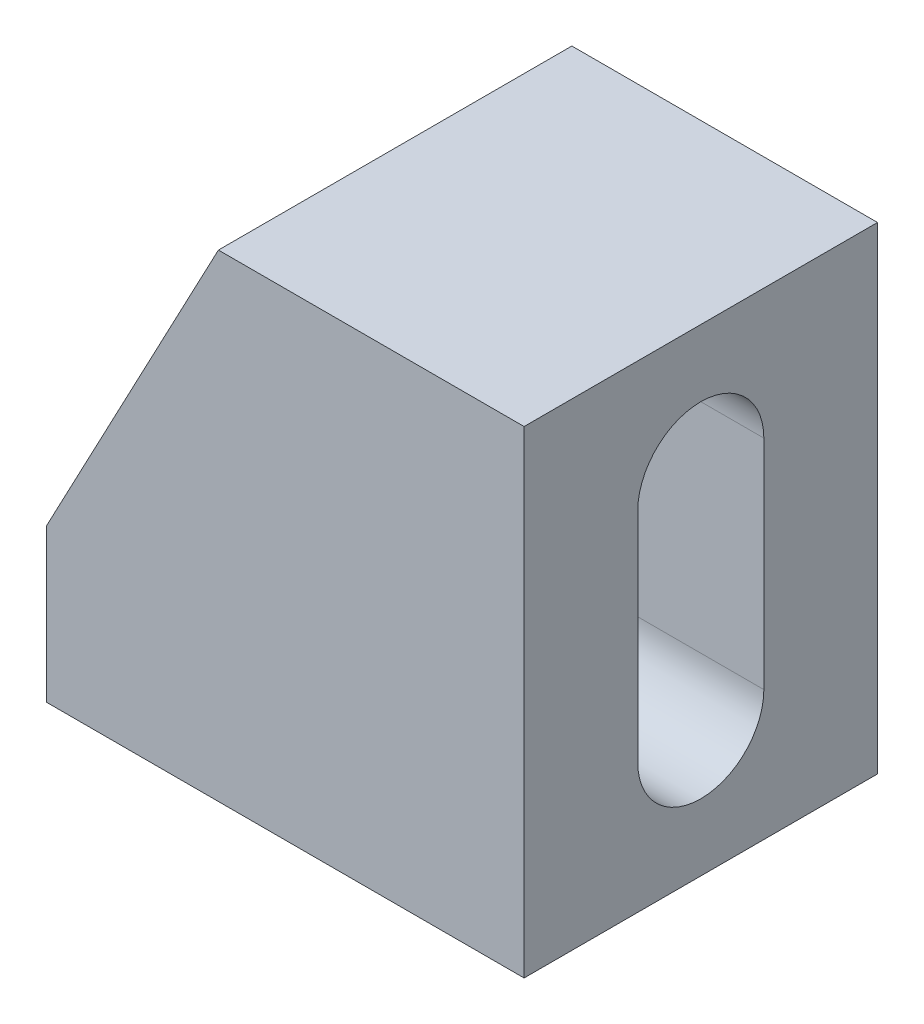
from build123d import *

# Parameters (mm, degrees)
BOSS_EXTRUDE2_DEPTH      = 9.25
M6_CLEARANCE_SLOT1_DEPTH = 25


# Read off the part's stored shape, not the designer's step: M6 Clearance Slot1
with BuildPart() as part:
    # Sketch2 → Boss-Extrude2 (new, symmetric)
    with BuildSketch(Plane.XY):
        Polygon((0, 0), (0, 8), (9, 25), (25, 25), (25, 0), align=None)
    extrude(amount=BOSS_EXTRUDE2_DEPTH, both=True)

    # M6 Clearance Slot1 outline → M6 Clearance Slot1 (cut)
    with BuildSketch(Plane.YZ):
        with BuildLine():
            Line((6.8, -3.3), (18.2, -3.3))
            ThreePointArc((18.2, -3.3), (21.5, 0), (18.2, 3.3))
            Line((18.2, 3.3), (6.8, 3.3))
            ThreePointArc((6.8, 3.3), (3.5, 0), (6.8, -3.3))
        make_face()
    extrude(amount=M6_CLEARANCE_SLOT1_DEPTH, mode=Mode.SUBTRACT)


solid = part.part
